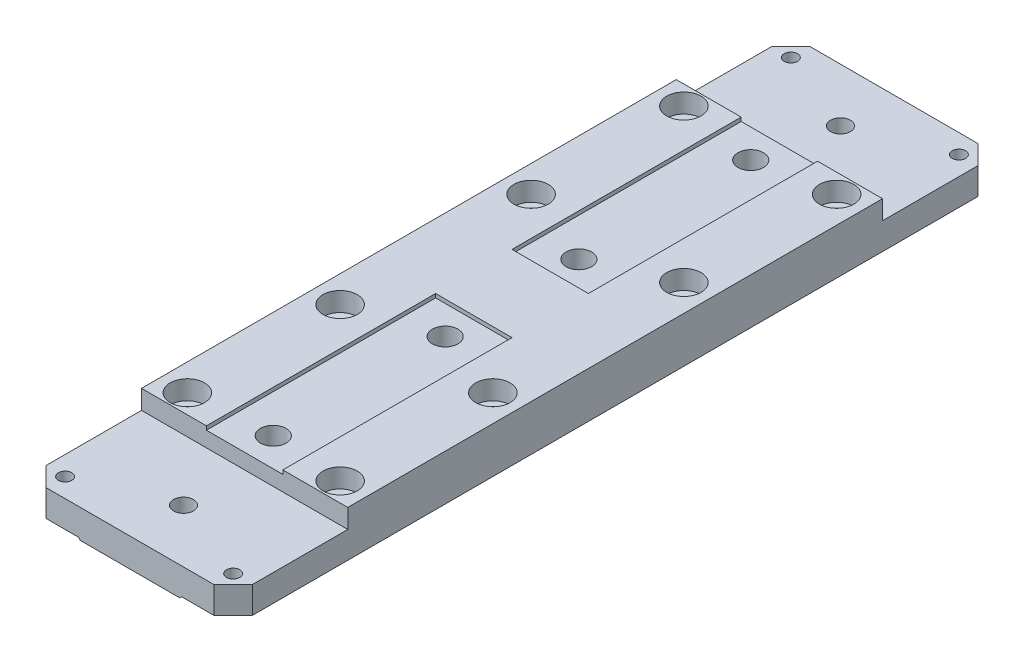
from build123d import *

# Parameters (mm, degrees)
SKETCH1_W               = 54
SKETCH1_H               = 200
SKETCH1_R               = 2.6
SKETCH1_R_2             = 3.35
BOSS_EXTRUDE1_DEPTH     = 12
SKETCH4_R               = 5.25
CUT_EXTRUDE2_DEPTH      = 6
CUT_EXTRUDE3_START      = 12
SKETCH5_W               = 20
SKETCH5_H               = 60
CUT_EXTRUDE3_DEPTH      = 1
CUT_EXTRUDE4_DEPTH      = 105.273678366
CUT_EXTRUDE4_DEPTH_BACK = 105.273678366
SKETCH6_R               = 1.75
CUT_EXTRUDE5_DEPTH      = 3
CHAMFER2_SIZE           = 5
BOSS_EXTRUDE3_START     = -0.5
SKETCH9_W               = 27
SKETCH9_H               = 200
SKETCH9_R               = 2.6
SKETCH9_R_2             = 5.25
BOSS_EXTRUDE3_DEPTH     = 0.5
CHAMFER3_SIZE           = 0.5
SKETCH10_W              = 54
SKETCH10_H              = 30
CUT_EXTRUDE6_DEPTH      = 5
CUT_EXTRUDE7_START      = 12
SKETCH11_R              = 4.5
CUT_EXTRUDE7_DEPTH      = 5


with BuildPart() as part:
    # Sketch1 → Boss-Extrude1 (new body)
    with BuildSketch(Plane(origin=(0, 0, 0), x_dir=(1, 0, 0), z_dir=(0, 1, 0))):
        Rectangle(SKETCH1_W, SKETCH1_H)
        with Locations(Location((0, 86, 0), (0, 0, 270))):
            Circle(SKETCH1_R, mode=Mode.SUBTRACT)
        with Locations(Location((0, -86, 0), (0, 0, 270))):
            Circle(SKETCH1_R, mode=Mode.SUBTRACT)
        with Locations(Location((0, 62.5, 0), (0, 0, 270))):
            Circle(SKETCH1_R_2, mode=Mode.SUBTRACT)
        with Locations(Location((0, 17.5, 0), (0, 0, 270))):
            Circle(SKETCH1_R_2, mode=Mode.SUBTRACT)
        with Locations(Location((0, -17.5, 0), (0, 0, 270))):
            Circle(SKETCH1_R_2, mode=Mode.SUBTRACT)
        with Locations(Location((0, -62.5, 0), (0, 0, 270))):
            Circle(SKETCH1_R_2, mode=Mode.SUBTRACT)
        with Locations(Location((-20, -65, 0), (0, 0, 270))):
            Circle(SKETCH1_R, mode=Mode.SUBTRACT)
        with Locations(Location((20, -65, 0), (0, 0, 270))):
            Circle(SKETCH1_R, mode=Mode.SUBTRACT)
        with Locations(Location((20, -25, 0), (0, 0, 270))):
            Circle(SKETCH1_R, mode=Mode.SUBTRACT)
        with Locations(Location((-20, -25, 0), (0, 0, 270))):
            Circle(SKETCH1_R, mode=Mode.SUBTRACT)
        with Locations(Location((-20, 25, 0), (0, 0, 270))):
            Circle(SKETCH1_R, mode=Mode.SUBTRACT)
        with Locations(Location((20, 25, 0), (0, 0, 270))):
            Circle(SKETCH1_R, mode=Mode.SUBTRACT)
        with Locations(Location((20, 65, 0), (0, 0, 270))):
            Circle(SKETCH1_R, mode=Mode.SUBTRACT)
        with Locations(Location((-20, 65, 0), (0, 0, 270))):
            Circle(SKETCH1_R, mode=Mode.SUBTRACT)
    extrude(amount=BOSS_EXTRUDE1_DEPTH)

    # Sketch4 → Cut-Extrude2 (cut)
    with BuildSketch(Plane(origin=(0, 0, 0), x_dir=(1, 0, 0), z_dir=(0, 1, 0))):
        with Locations(Location((0, 62.5, 0), (0, 0, 270))):
            Circle(SKETCH4_R)
        with Locations(Location((0, 17.5, 0), (0, 0, 270))):
            Circle(SKETCH4_R)
        with Locations(Location((0, -17.5, 0), (0, 0, 270))):
            Circle(SKETCH4_R)
        with Locations(Location((0, -62.5, 0), (0, 0, 270))):
            Circle(SKETCH4_R)
    extrude(amount=CUT_EXTRUDE2_DEPTH, mode=Mode.SUBTRACT)

    # Sketch5 → Cut-Extrude3 (cut)
    with BuildSketch(Plane(origin=(0, 0, 0), x_dir=(1, 0, 0), z_dir=(0, 1, 0)).offset(CUT_EXTRUDE3_START)):
        with Locations((0, 40)):
            Rectangle(SKETCH5_W, SKETCH5_H)
        with Locations((0, -40)):
            Rectangle(SKETCH5_W, SKETCH5_H)
    extrude(amount=-CUT_EXTRUDE3_DEPTH, mode=Mode.SUBTRACT)

    # Sketch6 → Cut-Extrude4 (cut, two sides: drawn at the far end of the back side and taken through both)
    with BuildSketch(Plane(origin=(0, 0, 0), x_dir=(1, 0, 0), z_dir=(0, 1, 0)).offset(-CUT_EXTRUDE4_DEPTH_BACK)):
        with Locations(Location((22, 95, 0), (0, 0, 90))):
            Circle(SKETCH6_R)
        with Locations(Location((22, -95, 0), (0, 0, 90))):
            Circle(SKETCH6_R)
        with Locations(Location((-22, -95, 0), (0, 0, 90))):
            Circle(SKETCH6_R)
        with Locations(Location((-22, 95, 0), (0, 0, 90))):
            Circle(SKETCH6_R)
    extrude(amount=CUT_EXTRUDE4_DEPTH + CUT_EXTRUDE4_DEPTH_BACK, mode=Mode.SUBTRACT)

    # Sketch7 → Cut-Extrude5 (cut)
    with BuildSketch(Plane(origin=(0, 0, 0), x_dir=(1, 0, 0), z_dir=(0, 1, 0))):
        Polygon((18.535898385, 95), (20.267949192, 92), (23.732050808, 92), (25.464101615, 95), (23.732050808, 98), (20.267949192, 98), align=None)
        Polygon((18.535898385, -95), (20.267949192, -98), (23.732050808, -98), (25.464101615, -95), (23.732050808, -92), (20.267949192, -92), align=None)
        Polygon((-25.464101615, -95), (-23.732050808, -98), (-20.267949192, -98), (-18.535898385, -95), (-20.267949192, -92), (-23.732050808, -92), align=None)
        Polygon((-25.464101615, 95), (-23.732050808, 92), (-20.267949192, 92), (-18.535898385, 95), (-20.267949192, 98), (-23.732050808, 98), align=None)
    extrude(amount=CUT_EXTRUDE5_DEPTH, mode=Mode.SUBTRACT)

    # Chamfer2
    chamfer2_edges = [part.edges().sort_by_distance(p)[0] for p in [
        (27, 6, 100),
        (-27, 6, 100),
        (-27, 6, -100),
        (27, 6, -100),
    ]]
    chamfer(chamfer2_edges, length=CHAMFER2_SIZE)

    # Sketch9 → Boss-Extrude3 (add)
    with BuildSketch(Plane(origin=(0, 0, 0), x_dir=(1, 0, 0), z_dir=(0, 1, 0)).offset(BOSS_EXTRUDE3_START)):
        Rectangle(SKETCH9_W, SKETCH9_H)
        with Locations(Location((0, -86, 0), (0, 0, 270))):
            Circle(SKETCH9_R, mode=Mode.SUBTRACT)
        with Locations(Location((0, -62.5, 0), (0, 0, 270))):
            Circle(SKETCH9_R_2, mode=Mode.SUBTRACT)
        with Locations(Location((0, -17.5, 0), (0, 0, 270))):
            Circle(SKETCH9_R_2, mode=Mode.SUBTRACT)
        with Locations(Location((0, 17.5, 0), (0, 0, 270))):
            Circle(SKETCH9_R_2, mode=Mode.SUBTRACT)
        with Locations(Location((0, 62.5, 0), (0, 0, 270))):
            Circle(SKETCH9_R_2, mode=Mode.SUBTRACT)
        with Locations(Location((0, 86, 0), (0, 0, 270))):
            Circle(SKETCH9_R, mode=Mode.SUBTRACT)
    extrude(amount=BOSS_EXTRUDE3_DEPTH)

    # Chamfer3
    chamfer3_edges = [part.edges().sort_by_distance(p)[0] for p in [
        (-13.5, -0.5, 0),
        (13.5, -0.5, 0),
    ]]
    chamfer(chamfer3_edges, length=CHAMFER3_SIZE - 0.0001)  # a hair under: the kernel refuses the full size

    # Sketch10 → Cut-Extrude6 (cut)
    with BuildSketch(Plane(origin=(0, 12, 0), x_dir=(1, 0, 0), z_dir=(0, 1, 0))):
        with Locations((0, -85)):
            Rectangle(SKETCH10_W, SKETCH10_H)
        with Locations((0, 85)):
            Rectangle(SKETCH10_W, SKETCH10_H)
    extrude(amount=-CUT_EXTRUDE6_DEPTH, mode=Mode.SUBTRACT)

    # Sketch11 → Cut-Extrude7 (cut)
    with BuildSketch(Plane(origin=(0, 0, 0), x_dir=(1, 0, 0), z_dir=(0, 1, 0)).offset(CUT_EXTRUDE7_START)):
        with Locations(Location((20, 65, 0), (0, 0, 90))):
            Circle(SKETCH11_R)
        with Locations(Location((-20, 65, 0), (0, 0, 90))):
            Circle(SKETCH11_R)
        with Locations(Location((-20, 25, 0), (0, 0, 90))):
            Circle(SKETCH11_R)
        with Locations(Location((20, 25, 0), (0, 0, 90))):
            Circle(SKETCH11_R)
        with Locations(Location((20, -25, 0), (0, 0, 90))):
            Circle(SKETCH11_R)
        with Locations(Location((-20, -25, 0), (0, 0, 90))):
            Circle(SKETCH11_R)
        with Locations(Location((-20, -65, 0), (0, 0, 90))):
            Circle(SKETCH11_R)
        with Locations(Location((20, -65, 0), (0, 0, 90))):
            Circle(SKETCH11_R)
    extrude(amount=-CUT_EXTRUDE7_DEPTH, mode=Mode.SUBTRACT)


solid = part.part
